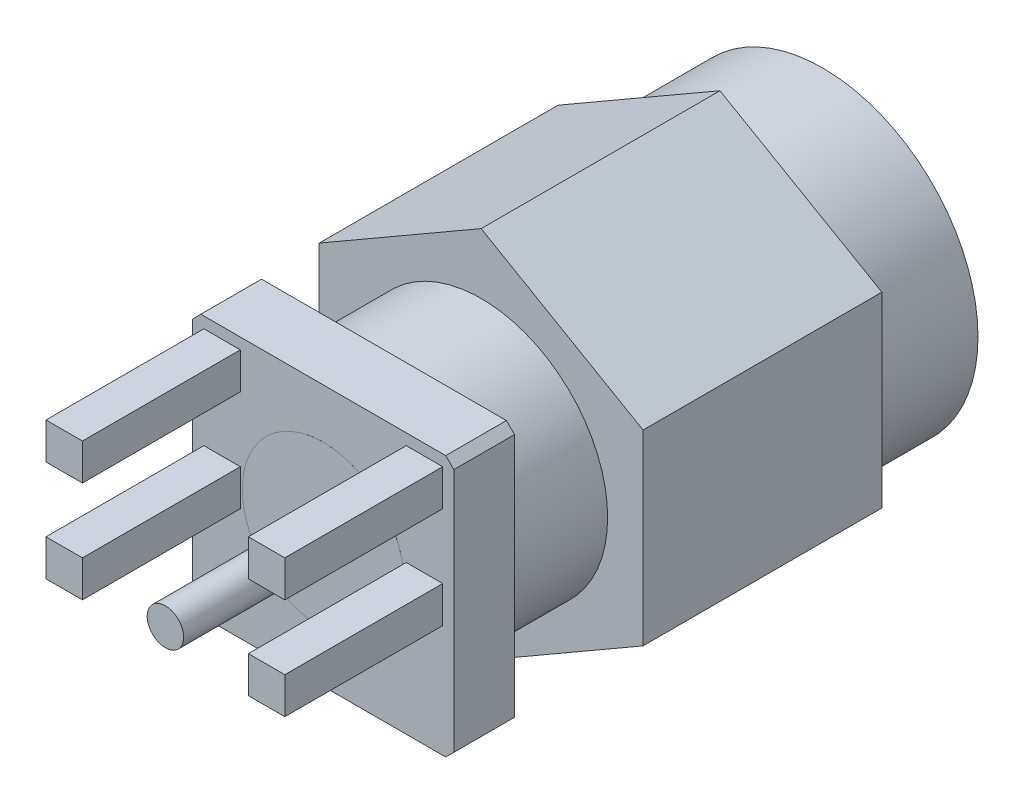
from build123d import *

# Parameters (mm, degrees)
SKETCH_1_W           = 0.9
SKETCH_1_H           = 0.9
EXTRUDE_1_DEPTH      = 3.9
EXTRUDE_1_2_DEPTH    = 3.9
EXTRUDE_1_3_DEPTH    = 3.9
EXTRUDE_1_4_DEPTH    = 3.9
SKETCH_1_3_W         = 6.45
SKETCH_1_3_H         = 6.45
EXTRUDE_2_DEPTH      = 1.5
SKETCH_1_4_R         = 3.125
EXTRUDE_3_DEPTH      = 3.9
EXTRUDE_START        = -3.9
EXTRUDE_4_DEPTH      = 5.9
EXTRUDE_START_2      = -9.8
SKETCH_1_6_R         = 3.835
EXTRUDE_5_DEPTH      = 2.54
SKETCH_2_R           = 3.335
CUT_EXTRUDE_1_DEPTH  = 6
SKETCH_1_7_R         = 2
SKETCH_1_7_R_2       = 0.45
CUT_EXTRUDE_2_DEPTH  = 9
EXTRUDE_6_DEPTH      = 3.9
EXTRUDE_6_DEPTH_BACK = 12
SKETCH_1_8_R         = 0.45
EXTRUDE_7_DEPTH      = 0.0004
EXTRUDE_7_DEPTH_BACK = 8.4
SKETCH_1_9_R         = 2
SKETCH_1_9_R_2       = 0.45
THREAD_1_PITCH       = 0.8
FILLET_1_SIZE        = 0.35
CHAMFER_1_SIZE       = 0.2


with BuildPart() as part:
    # Sketch 1 → Бобышка-Вытянуть1 (new body)
    with BuildSketch(Plane.XY):
        with Locations((-2.5, 2.5)):
            Rectangle(SKETCH_1_W, SKETCH_1_H)
    extrude(amount=EXTRUDE_1_DEPTH)



with BuildPart() as body_2:
    # Sketch 1 → Extrude 1 2 (new body)
    with BuildSketch(Plane.XY):
        with Locations((2.5, 2.5)):
            Rectangle(SKETCH_1_W, SKETCH_1_H)
    extrude(amount=EXTRUDE_1_2_DEPTH)


with BuildPart() as body_3:
    # Sketch 1 → Extrude 1 3 (new body)
    with BuildSketch(Plane.XY):
        with Locations((-2.5, 0)):
            Rectangle(SKETCH_1_W, SKETCH_1_H)
    extrude(amount=EXTRUDE_1_3_DEPTH)


with BuildPart() as body_4:
    # Sketch 1 → Extrude 1 4 (new body)
    with BuildSketch(Plane.XY):
        with Locations((2.5, 0)):
            Rectangle(SKETCH_1_W, SKETCH_1_H)
    extrude(amount=EXTRUDE_1_4_DEPTH)


with BuildPart() as part_1:
    add(part.part)

    add(body_2.part)  # Бобышка-Вытянуть2 merges body 2

    add(body_3.part)  # Бобышка-Вытянуть2 merges body 3

    add(body_4.part)  # Бобышка-Вытянуть2 merges body 4
    # Эскиз1<3> → Бобышка-Вытянуть2 (add)
    with BuildSketch(Plane.XY):
        Rectangle(SKETCH_1_3_W, SKETCH_1_3_H)
    extrude(amount=-EXTRUDE_2_DEPTH)

    # Эскиз1<4> → Бобышка-Вытянуть3 (add)
    with BuildSketch(Plane.XY):
        Circle(SKETCH_1_4_R)
    extrude(amount=-EXTRUDE_3_DEPTH)

    # Эскиз1<5> → Бобышка-Вытянуть4 (add)
    with BuildSketch(Plane.XY.offset(EXTRUDE_START)):
        Polygon((0, 4.618802154), (-4, 2.309401077), (-4, -2.309401077), (0, -4.618802154), (4, -2.309401077), (4, 2.309401077), align=None)
    extrude(amount=-EXTRUDE_4_DEPTH)

    # Эскиз1<6> → Бобышка-Вытянуть5 (add)
    with BuildSketch(Plane.XY.offset(EXTRUDE_START_2)):
        Circle(SKETCH_1_6_R)
    extrude(amount=-EXTRUDE_5_DEPTH)

    # Эскиз2 → Вырез-Вытянуть1 (cut)
    with BuildSketch(Plane(origin=(0, 0, -12.34), x_dir=(-1, 0, 0), z_dir=(0, 0, -1))):
        Circle(SKETCH_2_R)
    extrude(amount=-CUT_EXTRUDE_1_DEPTH, mode=Mode.SUBTRACT)

    # Эскиз1<7> → Вырез-Вытянуть2 (cut)
    with BuildSketch(Plane.XY):
        Circle(SKETCH_1_7_R)
        Circle(SKETCH_1_7_R_2, mode=Mode.SUBTRACT)
    extrude(amount=-CUT_EXTRUDE_2_DEPTH, mode=Mode.SUBTRACT)


with BuildPart() as cut_extrude_2_piece_1:
    # of the separate pieces the step leaves, piece 1, a body of its own (cut_extrude_2_pieces)
    add(part_1.part.solids().sort_by_distance((0, 4.618802154, -3.9))[0])



with BuildPart() as cut_extrude_2_piece_2:
    # of the separate pieces the step leaves, piece 2, a body of its own (cut_extrude_2_pieces)
    add(part_1.part.solids().sort_by_distance((0.45, 0, 0))[0])

    # Эскиз1<8> → Бобышка-Вытянуть6 (add, two sides: drawn at the far end of the back side and taken through both)
    with BuildSketch(Plane.XY.offset(-EXTRUDE_6_DEPTH_BACK)):
        Circle(SKETCH_1_8_R)
    extrude(amount=EXTRUDE_6_DEPTH + EXTRUDE_6_DEPTH_BACK)


with BuildPart() as cut_extrude_2_piece_1_1:
    add(cut_extrude_2_piece_1.part)

    add(cut_extrude_2_piece_2.part)  # Бобышка-Вытянуть7 merges Вырез-Вытянуть2 piece 2
    # Эскиз1<9> → Бобышка-Вытянуть7 (add, two sides: drawn at the far end of the back side and taken through both)
    with BuildSketch(Plane.XY.offset(-EXTRUDE_7_DEPTH_BACK)):
        Circle(SKETCH_1_9_R)
        Circle(SKETCH_1_9_R_2, mode=Mode.SUBTRACT)
    extrude(amount=EXTRUDE_7_DEPTH + EXTRUDE_7_DEPTH_BACK)

    # Резьба1: arcs per turn and ends read off the stored shape
    # Резьба1: the profile of Sketch 1 2 profile screwed along a right-hand helix through 4.925 turns, 8 arcs to a turn; built about Z, then put on its axis
    thread_1_z = Axis((0, 0, 0), (0, 0, 1))
    thread_1_corners = [(3.3353, 0, -0.000173205), (3.3353, 0, 0.700173203), (2.9019873, 0, 0.449999999), (2.9019873, 0, 0.249999999)]
    with BuildLine(mode=Mode.PRIVATE) as thread_1_profile:
        Line(thread_1_corners[0], thread_1_corners[1])
        Line(thread_1_corners[1], thread_1_corners[2])
        Line(thread_1_corners[2], thread_1_corners[3])
        Line(thread_1_corners[3], thread_1_corners[0])
    thread_1_cap = Face(thread_1_profile.wire())
    thread_1_turn_angles = [0, 22.5, 45, 67.5, 90, 112.5, 135, 157.5, 180, 202.5, 225, 247.5, 270, 292.5, 315, 337.5, 360]
    thread_1_turn_weights = [1, 0.9238795325112867, 1, 0.9238795325112867, 1, 0.9238795325112867, 1, 0.9238795325112867, 1, 0.9238795325112867, 1, 0.9238795325112867, 1, 0.9238795325112867, 1, 0.9238795325112867, 1]
    thread_1_turn_rails = [Edge.make_bspline([Vector(p[0], p[1], 0).rotate(thread_1_z, thread_1_turn_angles[k]) / thread_1_turn_weights[k] + Vector(0, 0, p[2] + THREAD_1_PITCH * thread_1_turn_angles[k] / 360) for k in range(17)], [0, 0, 0, 1, 1, 2, 2, 3, 3, 4, 4, 5, 5, 6, 6, 7, 7, 8, 8, 8], 2, thread_1_turn_weights) for p in thread_1_corners]
    thread_1_turn_sides = [Face.make_surface_from_curves(thread_1_turn_rails[p[0]], thread_1_turn_rails[p[1]]) for p in [(0, 1), (1, 2), (2, 3), (3, 0)]]
    thread_1_last_angles = [1440, 1462.5, 1485, 1507.5, 1530, 1552.5, 1575, 1597.5, 1620, 1642.5, 1665, 1687.5, 1710, 1732.5, 1755, 1764, 1773]
    thread_1_last_weights = [1, 0.9238795325112867, 1, 0.9238795325112867, 1, 0.9238795325112867, 1, 0.9238795325112867, 1, 0.9238795325112867, 1, 0.9238795325112867, 1, 0.9238795325112867, 1, 0.9876883405951383, 1]
    thread_1_last_rails = [Edge.make_bspline([Vector(p[0], p[1], 0).rotate(thread_1_z, thread_1_last_angles[k]) / thread_1_last_weights[k] + Vector(0, 0, p[2] + THREAD_1_PITCH * thread_1_last_angles[k] / 360) for k in range(17)], [0, 0, 0, 1, 1, 2, 2, 3, 3, 4, 4, 5, 5, 6, 6, 7, 7, 8, 8, 8], 2, thread_1_last_weights) for p in thread_1_corners]
    thread_1_last_sides = [Face.make_surface_from_curves(thread_1_last_rails[p[0]], thread_1_last_rails[p[1]]) for p in [(0, 1), (1, 2), (2, 3), (3, 0)]]
    thread_1 = Plane(origin=(0, 0, -12.34), x_dir=(1, 0, 0), z_dir=(0, 0, 1)) * Solid(Shell([*[p.moved(Location((0, 0, THREAD_1_PITCH * i))) for i in range(4) for p in thread_1_turn_sides], *thread_1_last_sides, thread_1_cap, thread_1_cap.rotate(thread_1_z, 1773).moved(Location((0, 0, THREAD_1_PITCH * 1773 / 360)))]))
    add(thread_1)

    # Скругление1
    # a fillet whose section is not a circle: 0.35 mm, written as the material it takes off along each edge
    with BuildSketch(Plane(origin=(0, 0, -12), x_dir=(1, 0, 0), z_dir=(0, -1, 0))) as fillet_1_piece_1:
        with BuildLine():
            Bezier((0.45, FILLET_1_SIZE), (0.45, 0), (0.45 - FILLET_1_SIZE, 0), weights=[1, 0.494974747, 1])
            Line((0.45 - FILLET_1_SIZE, 0), (0.45, 0))
            Line((0.45, 0), (0.45, FILLET_1_SIZE))
        make_face()
    revolve(axis=Axis((0, 0, -12), (0, 0, 1)), mode=Mode.SUBTRACT)

    # Фаска1
    chamfer_1_edges = [cut_extrude_2_piece_1_1.edges().sort_by_distance(p)[0] for p in [
        (3.225, 3.225, -0.75),
        (3.225, -3.225, -0.75),
        (-3.225, -3.225, -0.75),
        (-3.225, 3.225, -0.75),
    ]]
    chamfer(chamfer_1_edges, length=CHAMFER_1_SIZE)


solid = cut_extrude_2_piece_1_1.part
